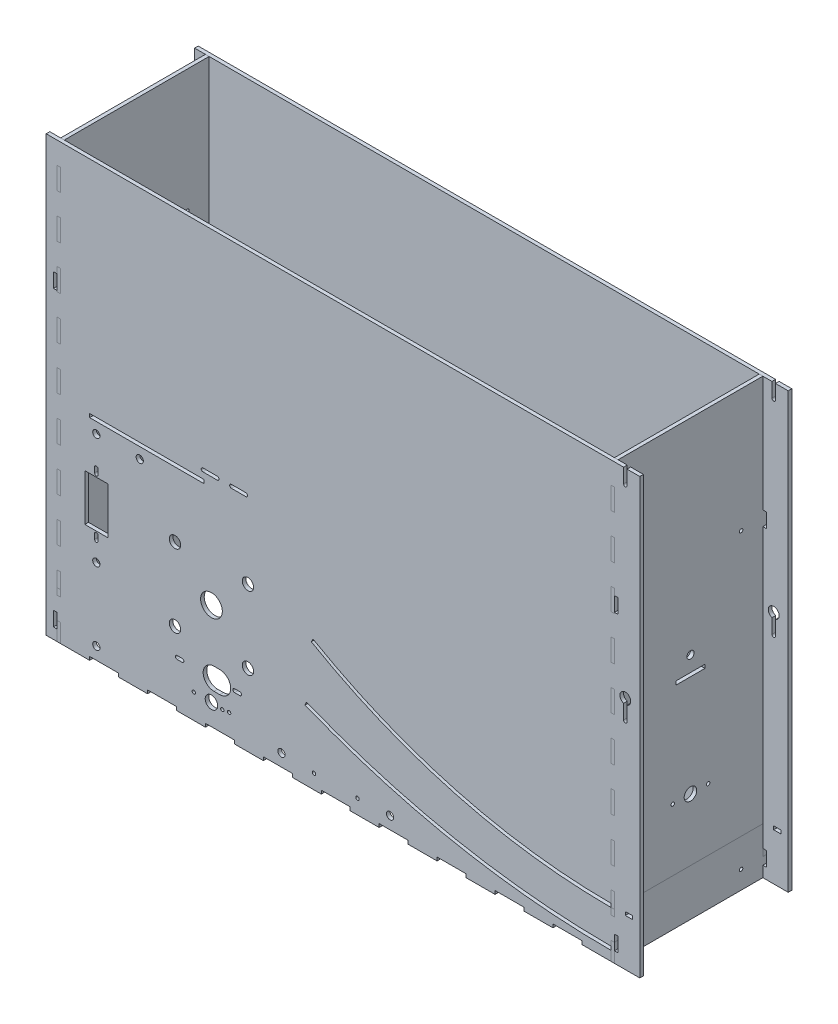
from build123d import *

# Parameters (mm, degrees)
SKETCH1_W                      = 488.95
SKETCH1_H                      = 133.35
SKETCH1_W_2                    = 482.6
SKETCH1_H_2                    = 127
BASE_EXTRUDE_DEPTH             = 3.175
SKETCH1_3_W                    = 488.95
SKETCH1_3_H                    = 133.35
SKETCH1_3_W_2                  = 482.6
SKETCH1_3_H_2                  = 127
WALL_EXTRUDE_DEPTH             = 384.175
WHEELRAMP7_W                   = 100.522513305
WHEELRAMP7_H                   = 3.175
WHEELRAMP7_R                   = 9.525
WHEELRAMP7_R_2                 = 5
CUT_EXTRUDE6_DEPTH             = 475.489914276
WHEELRAMP7_3_W                 = 20.2
WHEELRAMP7_3_H                 = 40.9
BRAKE_PAD_SERVO_CUT_DEPTH      = 475.489914276
WHEELRAMP7_4_R                 = 1.5
RATCHET_BRAKE_SERVO_CUT_DEPTH  = 475.489914276
WHEELRAMP7_5_R                 = 5.5
WHEELRAMP7_5_R_2               = 1.5
SOLENOIDBRAKE_DEPTH            = 475.489914276
SKETCH19_W                     = 25.4
SKETCH19_H                     = 3.175
SKETCH19_R                     = 3.175
SKETCH19_R_2                   = 5.5
SKETCH19_R_3                   = 1.5
SIDE_CUTS_DEPTH                = 626.386351586
SKETCH23_W                     = 6.35
SKETCH23_H                     = 2.9972
SKETCH23_W_2                   = 9.525
SKETCH23_H_2                   = 384.175
BOSS_EXTRUDE1_DEPTH            = 3.175
BOSS_EXTRUDE2_START            = -130.175
SKETCH23_2_W                   = 6.35
SKETCH23_2_H                   = 2.9972
SKETCH23_2_W_2                 = 9.525
SKETCH23_2_H_2                 = 384.175
BOSS_EXTRUDE2_DEPTH            = 3.175
SKETCH21_W                     = 12.827
SKETCH21_H                     = 6.477
SKETCH21_W_2                   = 6.477
SKETCH21_H_2                   = 12.827
SKETCH21_W_3                   = 3.175
BOTTOM_SUPPORT_HOLES_DEPTH     = 473.403298306
SPLIT1_START                   = 3.175
SPLIT1_OUTLINE_W               = 3.175
SPLIT1_OUTLINE_H               = 127
SPLIT1_DEPTH                   = 40.973335237
SPLIT1_2_OUTLINE_W             = 3.175
SPLIT1_2_OUTLINE_H             = 12.122727273
SPLIT1_2_DEPTH                 = 19.20875
SPLIT1_START_2                 = 38.4175
SPLIT1_3_OUTLINE_W             = 3.175
SPLIT1_3_OUTLINE_H             = 3.175
SPLIT1_3_DEPTH                 = 5.730835237
SPLIT1_START_3                 = -244.475
SPLIT1_4_OUTLINE_R             = 1.5
SPLIT1_4_OUTLINE_R_2           = 5.5
SPLIT1_4_OUTLINE_W             = 3.175
SPLIT1_4_OUTLINE_H             = 25.4
SPLIT1_4_OUTLINE_R_3           = 3.175
SPLIT1_4_DEPTH                 = 3.175
SPLIT1_5_OUTLINE_W             = 3.175
SPLIT1_5_OUTLINE_H             = 127
SPLIT1_5_DEPTH                 = 381.825
SPLIT1_START_4                 = -1
SPLIT1_6_OUTLINE_W             = 3.175
SPLIT1_6_OUTLINE_H             = 12.122727273
SPLIT1_6_DEPTH                 = 20.20875
SPLIT1_7_OUTLINE_W             = 3.175
SPLIT1_7_OUTLINE_H             = 3.175
SPLIT1_7_DEPTH                 = 19.20875
SPLIT1_START_5                 = 76.835
SPLIT1_8_OUTLINE_W             = 3.175
SPLIT1_8_OUTLINE_H             = 3.175
SPLIT1_8_DEPTH                 = 19.20875
SPLIT1_START_6                 = 115.2525
SPLIT1_9_OUTLINE_W             = 3.175
SPLIT1_9_OUTLINE_H             = 3.175
SPLIT1_9_DEPTH                 = 19.20875
SPLIT1_START_7                 = 153.67
SPLIT1_10_OUTLINE_W            = 3.175
SPLIT1_10_OUTLINE_H            = 3.175
SPLIT1_10_DEPTH                = 19.20875
SPLIT1_START_8                 = 192.0875
SPLIT1_11_OUTLINE_W            = 3.175
SPLIT1_11_OUTLINE_H            = 3.175
SPLIT1_11_DEPTH                = 19.20875
SPLIT1_START_9                 = 230.505
SPLIT1_12_OUTLINE_W            = 3.175
SPLIT1_12_OUTLINE_H            = 3.175
SPLIT1_12_DEPTH                = 19.20875
SPLIT1_START_10                = 268.9225
SPLIT1_13_OUTLINE_W            = 3.175
SPLIT1_13_OUTLINE_H            = 3.175
SPLIT1_13_DEPTH                = 19.20875
SPLIT1_START_11                = 307.34
SPLIT1_14_OUTLINE_W            = 3.175
SPLIT1_14_OUTLINE_H            = 3.175
SPLIT1_14_DEPTH                = 19.20875
SPLIT1_START_12                = 345.7575
SPLIT1_15_OUTLINE_W            = 3.175
SPLIT1_15_OUTLINE_H            = 3.175
SPLIT1_15_DEPTH                = 19.20875
SPLIT2_START                   = 3.175
SPLIT2_OUTLINE_W               = 3.175
SPLIT2_OUTLINE_H               = 127
SPLIT2_DEPTH                   = 40.973335237
SPLIT2_2_OUTLINE_W             = 3.175
SPLIT2_2_OUTLINE_H             = 12.122727273
SPLIT2_2_DEPTH                 = 19.20875
SPLIT2_START_2                 = 38.4175
SPLIT2_3_OUTLINE_W             = 3.175
SPLIT2_3_OUTLINE_H             = 3.175
SPLIT2_3_DEPTH                 = 5.730835237
SPLIT2_START_3                 = 241.3
SPLIT2_4_OUTLINE_R             = 1.5
SPLIT2_4_OUTLINE_R_2           = 5.5
SPLIT2_4_OUTLINE_W             = 3.175
SPLIT2_4_OUTLINE_H             = 25.4
SPLIT2_4_OUTLINE_R_3           = 3.175
SPLIT2_4_DEPTH                 = 3.175
SPLIT2_5_OUTLINE_W             = 3.175
SPLIT2_5_OUTLINE_H             = 127
SPLIT2_5_DEPTH                 = 381
SPLIT2_START_4                 = -1
SPLIT2_6_OUTLINE_W             = 3.175
SPLIT2_6_OUTLINE_H             = 12.122727273
SPLIT2_6_DEPTH                 = 20.20875
SPLIT2_7_OUTLINE_W             = 3.175
SPLIT2_7_OUTLINE_H             = 3.175
SPLIT2_7_DEPTH                 = 19.20875
SPLIT2_START_5                 = 76.835
SPLIT2_8_OUTLINE_W             = 3.175
SPLIT2_8_OUTLINE_H             = 3.175
SPLIT2_8_DEPTH                 = 19.20875
SPLIT2_START_6                 = 115.2525
SPLIT2_9_OUTLINE_W             = 3.175
SPLIT2_9_OUTLINE_H             = 3.175
SPLIT2_9_DEPTH                 = 19.20875
SPLIT2_START_7                 = 153.67
SPLIT2_10_OUTLINE_W            = 3.175
SPLIT2_10_OUTLINE_H            = 3.175
SPLIT2_10_DEPTH                = 19.20875
SPLIT2_START_8                 = 192.0875
SPLIT2_11_OUTLINE_W            = 3.175
SPLIT2_11_OUTLINE_H            = 3.175
SPLIT2_11_DEPTH                = 19.20875
SPLIT2_START_9                 = 230.505
SPLIT2_12_OUTLINE_W            = 3.175
SPLIT2_12_OUTLINE_H            = 3.175
SPLIT2_12_DEPTH                = 19.20875
SPLIT2_START_10                = 268.9225
SPLIT2_13_OUTLINE_W            = 3.175
SPLIT2_13_OUTLINE_H            = 3.175
SPLIT2_13_DEPTH                = 19.20875
SPLIT2_START_11                = 307.34
SPLIT2_14_OUTLINE_W            = 3.175
SPLIT2_14_OUTLINE_H            = 3.175
SPLIT2_14_DEPTH                = 19.20875
SPLIT2_START_12                = 345.7575
SPLIT2_15_OUTLINE_W            = 3.175
SPLIT2_15_OUTLINE_H            = 3.175
SPLIT2_15_DEPTH                = 19.20875
SKETCH22_W                     = 520.7
SKETCH22_H                     = 3.175
CUT_EXTRUDE5_DEPTH             = 487.314243185
SKETCH26_R                     = 1.5
SKETCH26_W                     = 3.175
SKETCH26_H                     = 12.7
FRONT_BACK_SUPPORT_HOLES_DEPTH = 487.314243185
SKETCH27_R                     = 1.5
SIDE_SUPPORT_HOLES_DEPTH       = 643.9120211
WHEELRAMP7_6_R                 = 3.175
WIREHOLECUT_DEPTH              = 487.314243185
SKETCH31_W                     = 25.4
SKETCH31_H                     = 6.1722
CUT_EXTRUDE10_DEPTH            = 487.314243185


with BuildPart() as part:
    # Sketch1 → Base Extrude (new body)
    # profile 1 of 2: a face of its own
    with BuildSketch(Plane(origin=(0, 0, 0), x_dir=(1, 0, 0), z_dir=(0, 1, 0))):
        Rectangle(SKETCH1_W, SKETCH1_H)
        Rectangle(SKETCH1_W_2, SKETCH1_H_2, mode=Mode.SUBTRACT)
    # profile 2 of 2: a face of its own
    with BuildSketch(Plane(origin=(0, 0, 0), x_dir=(1, 0, 0), z_dir=(0, 1, 0))):
        Rectangle(SKETCH1_W_2, SKETCH1_H_2)
    extrude(amount=BASE_EXTRUDE_DEPTH)

    # Sketch1<3> → Wall Extrude (add)
    with BuildSketch(Plane(origin=(0, 0, 0), x_dir=(1, 0, 0), z_dir=(0, 1, 0))):
        Rectangle(SKETCH1_3_W, SKETCH1_3_H)
        Rectangle(SKETCH1_3_W_2, SKETCH1_3_H_2, mode=Mode.SUBTRACT)
    extrude(amount=WALL_EXTRUDE_DEPTH)

    # WheelRamp7 → Cut-Extrude6 (cut, through all)
    with BuildSketch(Plane.XY.offset(66.675)):
        with BuildLine():
            Line((-19.862553934, 117.301630657), (-21.450053934, 114.552))
            ThreePointArc((-21.450053934, 114.552), (105.29056388, 62.054317198), (241.3, 44.148335237))
            Line((241.3, 44.148335237), (241.3, 47.323335237))
            ThreePointArc((241.3, 47.323335237), (106.112314349, 65.121131696), (-19.862553934, 117.301630657))
        make_face()
        with Locations((-165.638743347, 189.1665)):
            Rectangle(WHEELRAMP7_W, WHEELRAMP7_H)
        with BuildLine():
            Line((-103.827486695, 199.079), (-116.527486695, 199.079))
            ThreePointArc((-116.527486695, 199.079), (-118.027486695, 197.579), (-116.527486695, 196.079))
            Line((-116.527486695, 196.079), (-103.827486695, 196.079))
            ThreePointArc((-103.827486695, 196.079), (-102.327486695, 197.579), (-103.827486695, 199.079))
        make_face()
        with BuildLine():
            Line((-78.827486695, 199.079), (-91.527486695, 199.079))
            ThreePointArc((-91.527486695, 199.079), (-93.027486695, 197.579), (-91.527486695, 196.079))
            Line((-91.527486695, 196.079), (-78.827486695, 196.079))
            ThreePointArc((-78.827486695, 196.079), (-77.327486695, 197.579), (-78.827486695, 199.079))
        make_face()
        with BuildLine():
            Line((-25.734108325, 66.638172527), (-26.923484259, 63.694363788))
            ThreePointArc((-26.923484259, 63.694363788), (104.678129303, 24.712189892), (241.3, 11.557))
            Line((241.3, 11.557), (241.3, 14.732))
            ThreePointArc((241.3, 14.732), (105.283947863, 27.8288562), (-25.734108325, 66.638172527))
        make_face()
        with Locations((-109.027486695, 98.552)):
            Circle(WHEELRAMP7_R)
        with Locations((-141.027486695, 130.552)):
            Circle(WHEELRAMP7_R_2)
        with Locations((-77.027486695, 130.552)):
            Circle(WHEELRAMP7_R_2)
        with Locations((-141.027486695, 66.552)):
            Circle(WHEELRAMP7_R_2)
        with Locations((-77.027486695, 66.552)):
            Circle(WHEELRAMP7_R_2)
    extrude(amount=-CUT_EXTRUDE6_DEPTH, mode=Mode.SUBTRACT)

    # WheelRamp7<3> → Brake Pad Servo Cut (cut, through all)
    with BuildSketch(Plane.XY.offset(66.675)):
        with Locations((-210.035686695, 124.7948)):
            Rectangle(WHEELRAMP7_3_W, WHEELRAMP7_3_H)
        with BuildLine():
            Line((-211.535686695, 101.7948), (-211.535686695, 97.2948))
            ThreePointArc((-211.535686695, 97.2948), (-210.035686695, 95.7948), (-208.535686695, 97.2948))
            Line((-208.535686695, 97.2948), (-208.535686695, 101.7948))
            ThreePointArc((-208.535686695, 101.7948), (-210.035686695, 103.2948), (-211.535686695, 101.7948))
        make_face()
        with BuildLine():
            Line((-208.535686695, 147.7948), (-208.535686695, 152.2948))
            ThreePointArc((-208.535686695, 152.2948), (-210.035686695, 153.7948), (-211.535686695, 152.2948))
            Line((-211.535686695, 152.2948), (-211.535686695, 147.7948))
            ThreePointArc((-211.535686695, 147.7948), (-210.035686695, 146.2948), (-208.535686695, 147.7948))
        make_face()
    extrude(amount=-BRAKE_PAD_SERVO_CUT_DEPTH, mode=Mode.SUBTRACT)

    # WheelRamp7<4> → Ratchet Brake Servo Cut (cut, through all)
    with BuildSketch(Plane.XY.offset(66.675)):
        with Locations((-99.502486695, 24.0114074)):
            Circle(WHEELRAMP7_4_R)
        with BuildLine():
            Line((-101.697486695, 34.227), (-106.777486695, 34.227))
            ThreePointArc((-106.777486695, 34.227), (-116.302486695, 43.752), (-106.777486695, 53.277))
            Line((-106.777486695, 53.277), (-101.697486695, 53.277))
            ThreePointArc((-101.697486695, 53.277), (-92.172486695, 43.752), (-101.697486695, 34.227))
        make_face()
        with BuildLine():
            Line((-139.187486695, 45.252), (-134.687486695, 45.252))
            ThreePointArc((-134.687486695, 45.252), (-133.187486695, 43.752), (-134.687486695, 42.252))
            Line((-134.687486695, 42.252), (-139.187486695, 42.252))
            ThreePointArc((-139.187486695, 42.252), (-140.687486695, 43.752), (-139.187486695, 45.252))
        make_face()
        with BuildLine():
            Line((-84.187486695, 42.252), (-88.687486695, 42.252))
            ThreePointArc((-88.687486695, 42.252), (-90.187486695, 43.752), (-88.687486695, 45.252))
            Line((-88.687486695, 45.252), (-84.187486695, 45.252))
            ThreePointArc((-84.187486695, 45.252), (-82.687486695, 43.752), (-84.187486695, 42.252))
        make_face()
    extrude(amount=-RATCHET_BRAKE_SERVO_CUT_DEPTH, mode=Mode.SUBTRACT)

    # WheelRamp7<5> → SolenoidBrake (cut, through all)
    with BuildSketch(Plane.XY.offset(66.675)):
        with Locations((-109.027486695, 24.765)):
            Circle(WHEELRAMP7_5_R)
        with Locations((-124.527486695, 24.765)):
            Circle(WHEELRAMP7_5_R_2)
        with Locations((-93.527486695, 24.765)):
            Circle(WHEELRAMP7_5_R_2)
    extrude(amount=-SOLENOIDBRAKE_DEPTH, mode=Mode.SUBTRACT)

    # Sketch19 → Side Cuts (cut, through all)
    with BuildSketch(Plane.ZY.offset(244.475)):
        with Locations((0, 189.1665)):
            Rectangle(SKETCH19_W, SKETCH19_H)
        with Locations((0, 204.216)):
            Circle(SKETCH19_R)
        with Locations((0, 98.552)):
            Circle(SKETCH19_R_2)
        with Locations((-15.5, 98.552)):
            Circle(SKETCH19_R_3)
        with Locations((15.5, 98.552)):
            Circle(SKETCH19_R_3)
    extrude(amount=-SIDE_CUTS_DEPTH, mode=Mode.SUBTRACT)

    # Sketch23 → Boss-Extrude1 (add)
    # profile 1 of 2: a face of its own
    with BuildSketch(Plane.XY.offset(66.675)):
        with BuildLine():
            Line((252.5, 384.175), (244.475, 384.175))
            Line((244.475, 384.175), (244.475, 0))
            Line((244.475, 0), (266.7, 0))
            Line((266.7, 0), (266.7, 384.175))
            Line((266.7, 384.175), (255.5, 384.175))
            Line((255.5, 384.175), (255.5, 371.475))
            ThreePointArc((255.5, 371.475), (254, 369.975), (252.5, 371.475))
            Line((252.5, 371.475), (252.5, 384.175))
        make_face()
        with Locations((257.175, 45.824735237)):
            Rectangle(SKETCH23_W, SKETCH23_H, mode=Mode.SUBTRACT)
        with BuildLine():
            Line((252.5, 192.0875), (252.5, 204.7875))
            ThreePointArc((252.5, 204.7875), (251.212738239, 213.169292048), (258.7625, 209.307611309))
            ThreePointArc((258.7625, 209.307611309), (257.861680738, 206.520349548), (255.5, 204.7875))
            Line((255.5, 204.7875), (255.5, 192.0875))
            ThreePointArc((255.5, 192.0875), (254, 190.5875), (252.5, 192.0875))
        make_face(mode=Mode.SUBTRACT)
    # profile 2 of 2: a face of its own
    with BuildSketch(Plane.XY.offset(66.675)):
        with Locations((-249.2375, 192.0875)):
            Rectangle(SKETCH23_W_2, SKETCH23_H_2)
    extrude(amount=-BOSS_EXTRUDE1_DEPTH)

    # Sketch23<2> → Boss-Extrude2 (add)
    # profile 1 of 2: a face of its own
    with BuildSketch(Plane.XY.offset(66.675).offset(BOSS_EXTRUDE2_START)):
        with BuildLine():
            Line((252.5, 384.175), (244.475, 384.175))
            Line((244.475, 384.175), (244.475, 0))
            Line((244.475, 0), (266.7, 0))
            Line((266.7, 0), (266.7, 384.175))
            Line((266.7, 384.175), (255.5, 384.175))
            Line((255.5, 384.175), (255.5, 371.475))
            ThreePointArc((255.5, 371.475), (254, 369.975), (252.5, 371.475))
            Line((252.5, 371.475), (252.5, 384.175))
        make_face()
        with Locations((257.175, 45.824735237)):
            Rectangle(SKETCH23_2_W, SKETCH23_2_H, mode=Mode.SUBTRACT)
        with BuildLine():
            Line((252.5, 192.0875), (252.5, 204.7875))
            ThreePointArc((252.5, 204.7875), (251.212738239, 213.169292048), (258.7625, 209.307611309))
            ThreePointArc((258.7625, 209.307611309), (257.861680738, 206.520349548), (255.5, 204.7875))
            Line((255.5, 204.7875), (255.5, 192.0875))
            ThreePointArc((255.5, 192.0875), (254, 190.5875), (252.5, 192.0875))
        make_face(mode=Mode.SUBTRACT)
    # profile 2 of 2: a face of its own
    with BuildSketch(Plane.XY.offset(66.675).offset(BOSS_EXTRUDE2_START)):
        with Locations((-249.2375, 192.0875)):
            Rectangle(SKETCH23_2_W_2, SKETCH23_2_H_2)
    extrude(amount=-BOSS_EXTRUDE2_DEPTH)

    # Sketch21 → Bottom Support Holes (cut, through all)
    with BuildSketch(Plane.XZ):
        with Locations((0, 50.7365)):
            Rectangle(SKETCH21_W, SKETCH21_H)
        with Locations((-228.5365, 0)):
            Rectangle(SKETCH21_W_2, SKETCH21_H_2)
        with Locations((0, -50.7365)):
            Rectangle(SKETCH21_W, SKETCH21_H)
        with Locations((230.1875, 0)):
            Rectangle(SKETCH21_W_3, SKETCH21_H_2)
    extrude(amount=-BOTTOM_SUPPORT_HOLES_DEPTH, mode=Mode.SUBTRACT)

    # Split1 5 outline → Split1 5 (cut)
    with BuildSketch(Plane(origin=(0, 0, 0), x_dir=(1, 0, 0), z_dir=(0, 1, 0)).offset(SPLIT1_START)):
        with Locations((-242.8875, 0)):
            Rectangle(SPLIT1_5_OUTLINE_W, SPLIT1_5_OUTLINE_H)
    extrude(amount=SPLIT1_5_DEPTH, mode=Mode.SUBTRACT)

    # Split1 6 outline → Split1 6 (cut)
    with BuildSketch(Plane(origin=(0, 0, 0), x_dir=(1, 0, 0), z_dir=(0, 1, 0)).offset(SPLIT1_START_4)):
        with Locations((-242.8875, 60.613636363)):
            Rectangle(SPLIT1_6_OUTLINE_W, SPLIT1_6_OUTLINE_H)
        with Locations((-242.8875, 36.368181819)):
            Rectangle(SPLIT1_6_OUTLINE_W, SPLIT1_6_OUTLINE_H)
        with Locations((-242.8875, 12.122727273)):
            Rectangle(SPLIT1_6_OUTLINE_W, SPLIT1_6_OUTLINE_H)
        with Locations((-242.8875, -12.122727273)):
            Rectangle(SPLIT1_6_OUTLINE_W, SPLIT1_6_OUTLINE_H)
        with Locations((-242.8875, -36.368181819)):
            Rectangle(SPLIT1_6_OUTLINE_W, SPLIT1_6_OUTLINE_H)
        with Locations((-242.8875, -60.613636363)):
            Rectangle(SPLIT1_6_OUTLINE_W, SPLIT1_6_OUTLINE_H)
    extrude(amount=SPLIT1_6_DEPTH, mode=Mode.SUBTRACT)

    # Split1 7 outline → Split1 7 (cut)
    with BuildSketch(Plane(origin=(0, 0, 0), x_dir=(1, 0, 0), z_dir=(0, 1, 0)).offset(SPLIT1_START_2)):
        with Locations((-242.8875, 65.0875)):
            Rectangle(SPLIT1_7_OUTLINE_W, SPLIT1_7_OUTLINE_H)
        with Locations((-242.8875, -65.0875)):
            Rectangle(SPLIT1_7_OUTLINE_W, SPLIT1_7_OUTLINE_H)
    extrude(amount=SPLIT1_7_DEPTH, mode=Mode.SUBTRACT)

    # Split1 8 outline → Split1 8 (cut)
    with BuildSketch(Plane(origin=(0, 0, 0), x_dir=(1, 0, 0), z_dir=(0, 1, 0)).offset(SPLIT1_START_5)):
        with Locations((-242.8875, 65.0875)):
            Rectangle(SPLIT1_8_OUTLINE_W, SPLIT1_8_OUTLINE_H)
        with Locations((-242.8875, -65.0875)):
            Rectangle(SPLIT1_8_OUTLINE_W, SPLIT1_8_OUTLINE_H)
    extrude(amount=SPLIT1_8_DEPTH, mode=Mode.SUBTRACT)

    # Split1 9 outline → Split1 9 (cut)
    with BuildSketch(Plane(origin=(0, 0, 0), x_dir=(1, 0, 0), z_dir=(0, 1, 0)).offset(SPLIT1_START_6)):
        with Locations((-242.8875, 65.0875)):
            Rectangle(SPLIT1_9_OUTLINE_W, SPLIT1_9_OUTLINE_H)
        with Locations((-242.8875, -65.0875)):
            Rectangle(SPLIT1_9_OUTLINE_W, SPLIT1_9_OUTLINE_H)
    extrude(amount=SPLIT1_9_DEPTH, mode=Mode.SUBTRACT)

    # Split1 10 outline → Split1 10 (cut)
    with BuildSketch(Plane(origin=(0, 0, 0), x_dir=(1, 0, 0), z_dir=(0, 1, 0)).offset(SPLIT1_START_7)):
        with Locations((-242.8875, 65.0875)):
            Rectangle(SPLIT1_10_OUTLINE_W, SPLIT1_10_OUTLINE_H)
        with Locations((-242.8875, -65.0875)):
            Rectangle(SPLIT1_10_OUTLINE_W, SPLIT1_10_OUTLINE_H)
    extrude(amount=SPLIT1_10_DEPTH, mode=Mode.SUBTRACT)

    # Split1 11 outline → Split1 11 (cut)
    with BuildSketch(Plane(origin=(0, 0, 0), x_dir=(1, 0, 0), z_dir=(0, 1, 0)).offset(SPLIT1_START_8)):
        with Locations((-242.8875, 65.0875)):
            Rectangle(SPLIT1_11_OUTLINE_W, SPLIT1_11_OUTLINE_H)
        with Locations((-242.8875, -65.0875)):
            Rectangle(SPLIT1_11_OUTLINE_W, SPLIT1_11_OUTLINE_H)
    extrude(amount=SPLIT1_11_DEPTH, mode=Mode.SUBTRACT)

    # Split1 12 outline → Split1 12 (cut)
    with BuildSketch(Plane(origin=(0, 0, 0), x_dir=(1, 0, 0), z_dir=(0, 1, 0)).offset(SPLIT1_START_9)):
        with Locations((-242.8875, 65.0875)):
            Rectangle(SPLIT1_12_OUTLINE_W, SPLIT1_12_OUTLINE_H)
        with Locations((-242.8875, -65.0875)):
            Rectangle(SPLIT1_12_OUTLINE_W, SPLIT1_12_OUTLINE_H)
    extrude(amount=SPLIT1_12_DEPTH, mode=Mode.SUBTRACT)

    # Split1 13 outline → Split1 13 (cut)
    with BuildSketch(Plane(origin=(0, 0, 0), x_dir=(1, 0, 0), z_dir=(0, 1, 0)).offset(SPLIT1_START_10)):
        with Locations((-242.8875, 65.0875)):
            Rectangle(SPLIT1_13_OUTLINE_W, SPLIT1_13_OUTLINE_H)
        with Locations((-242.8875, -65.0875)):
            Rectangle(SPLIT1_13_OUTLINE_W, SPLIT1_13_OUTLINE_H)
    extrude(amount=SPLIT1_13_DEPTH, mode=Mode.SUBTRACT)

    # Split1 14 outline → Split1 14 (cut)
    with BuildSketch(Plane(origin=(0, 0, 0), x_dir=(1, 0, 0), z_dir=(0, 1, 0)).offset(SPLIT1_START_11)):
        with Locations((-242.8875, 65.0875)):
            Rectangle(SPLIT1_14_OUTLINE_W, SPLIT1_14_OUTLINE_H)
        with Locations((-242.8875, -65.0875)):
            Rectangle(SPLIT1_14_OUTLINE_W, SPLIT1_14_OUTLINE_H)
    extrude(amount=SPLIT1_14_DEPTH, mode=Mode.SUBTRACT)

    # Split1 15 outline → Split1 15 (cut)
    with BuildSketch(Plane(origin=(0, 0, 0), x_dir=(1, 0, 0), z_dir=(0, 1, 0)).offset(SPLIT1_START_12)):
        with Locations((-242.8875, 65.0875)):
            Rectangle(SPLIT1_15_OUTLINE_W, SPLIT1_15_OUTLINE_H)
        with Locations((-242.8875, -65.0875)):
            Rectangle(SPLIT1_15_OUTLINE_W, SPLIT1_15_OUTLINE_H)
    extrude(amount=SPLIT1_15_DEPTH, mode=Mode.SUBTRACT)

    # Split2 5 outline → Split2 5 (cut)
    with BuildSketch(Plane(origin=(0, 0, 0), x_dir=(1, 0, 0), z_dir=(0, 1, 0)).offset(SPLIT2_START)):
        with Locations((242.8875, 0)):
            Rectangle(SPLIT2_5_OUTLINE_W, SPLIT2_5_OUTLINE_H)
    extrude(amount=SPLIT2_5_DEPTH, mode=Mode.SUBTRACT)

    # Split2 6 outline → Split2 6 (cut)
    with BuildSketch(Plane(origin=(0, 0, 0), x_dir=(1, 0, 0), z_dir=(0, 1, 0)).offset(SPLIT2_START_4)):
        with Locations((242.8875, 60.613636363)):
            Rectangle(SPLIT2_6_OUTLINE_W, SPLIT2_6_OUTLINE_H)
        with Locations((242.8875, 36.368181819)):
            Rectangle(SPLIT2_6_OUTLINE_W, SPLIT2_6_OUTLINE_H)
        with Locations((242.8875, 12.122727273)):
            Rectangle(SPLIT2_6_OUTLINE_W, SPLIT2_6_OUTLINE_H)
        with Locations((242.8875, -12.122727273)):
            Rectangle(SPLIT2_6_OUTLINE_W, SPLIT2_6_OUTLINE_H)
        with Locations((242.8875, -36.368181819)):
            Rectangle(SPLIT2_6_OUTLINE_W, SPLIT2_6_OUTLINE_H)
        with Locations((242.8875, -60.613636363)):
            Rectangle(SPLIT2_6_OUTLINE_W, SPLIT2_6_OUTLINE_H)
    extrude(amount=SPLIT2_6_DEPTH, mode=Mode.SUBTRACT)

    # Split2 7 outline → Split2 7 (cut)
    with BuildSketch(Plane(origin=(0, 0, 0), x_dir=(1, 0, 0), z_dir=(0, 1, 0)).offset(SPLIT2_START_2)):
        with Locations((242.8875, 65.0875)):
            Rectangle(SPLIT2_7_OUTLINE_W, SPLIT2_7_OUTLINE_H)
        with Locations((242.8875, -65.0875)):
            Rectangle(SPLIT2_7_OUTLINE_W, SPLIT2_7_OUTLINE_H)
    extrude(amount=SPLIT2_7_DEPTH, mode=Mode.SUBTRACT)

    # Split2 8 outline → Split2 8 (cut)
    with BuildSketch(Plane(origin=(0, 0, 0), x_dir=(1, 0, 0), z_dir=(0, 1, 0)).offset(SPLIT2_START_5)):
        with Locations((242.8875, 65.0875)):
            Rectangle(SPLIT2_8_OUTLINE_W, SPLIT2_8_OUTLINE_H)
        with Locations((242.8875, -65.0875)):
            Rectangle(SPLIT2_8_OUTLINE_W, SPLIT2_8_OUTLINE_H)
    extrude(amount=SPLIT2_8_DEPTH, mode=Mode.SUBTRACT)

    # Split2 9 outline → Split2 9 (cut)
    with BuildSketch(Plane(origin=(0, 0, 0), x_dir=(1, 0, 0), z_dir=(0, 1, 0)).offset(SPLIT2_START_6)):
        with Locations((242.8875, 65.0875)):
            Rectangle(SPLIT2_9_OUTLINE_W, SPLIT2_9_OUTLINE_H)
        with Locations((242.8875, -65.0875)):
            Rectangle(SPLIT2_9_OUTLINE_W, SPLIT2_9_OUTLINE_H)
    extrude(amount=SPLIT2_9_DEPTH, mode=Mode.SUBTRACT)

    # Split2 10 outline → Split2 10 (cut)
    with BuildSketch(Plane(origin=(0, 0, 0), x_dir=(1, 0, 0), z_dir=(0, 1, 0)).offset(SPLIT2_START_7)):
        with Locations((242.8875, 65.0875)):
            Rectangle(SPLIT2_10_OUTLINE_W, SPLIT2_10_OUTLINE_H)
        with Locations((242.8875, -65.0875)):
            Rectangle(SPLIT2_10_OUTLINE_W, SPLIT2_10_OUTLINE_H)
    extrude(amount=SPLIT2_10_DEPTH, mode=Mode.SUBTRACT)

    # Split2 11 outline → Split2 11 (cut)
    with BuildSketch(Plane(origin=(0, 0, 0), x_dir=(1, 0, 0), z_dir=(0, 1, 0)).offset(SPLIT2_START_8)):
        with Locations((242.8875, 65.0875)):
            Rectangle(SPLIT2_11_OUTLINE_W, SPLIT2_11_OUTLINE_H)
        with Locations((242.8875, -65.0875)):
            Rectangle(SPLIT2_11_OUTLINE_W, SPLIT2_11_OUTLINE_H)
    extrude(amount=SPLIT2_11_DEPTH, mode=Mode.SUBTRACT)

    # Split2 12 outline → Split2 12 (cut)
    with BuildSketch(Plane(origin=(0, 0, 0), x_dir=(1, 0, 0), z_dir=(0, 1, 0)).offset(SPLIT2_START_9)):
        with Locations((242.8875, 65.0875)):
            Rectangle(SPLIT2_12_OUTLINE_W, SPLIT2_12_OUTLINE_H)
        with Locations((242.8875, -65.0875)):
            Rectangle(SPLIT2_12_OUTLINE_W, SPLIT2_12_OUTLINE_H)
    extrude(amount=SPLIT2_12_DEPTH, mode=Mode.SUBTRACT)

    # Split2 13 outline → Split2 13 (cut)
    with BuildSketch(Plane(origin=(0, 0, 0), x_dir=(1, 0, 0), z_dir=(0, 1, 0)).offset(SPLIT2_START_10)):
        with Locations((242.8875, 65.0875)):
            Rectangle(SPLIT2_13_OUTLINE_W, SPLIT2_13_OUTLINE_H)
        with Locations((242.8875, -65.0875)):
            Rectangle(SPLIT2_13_OUTLINE_W, SPLIT2_13_OUTLINE_H)
    extrude(amount=SPLIT2_13_DEPTH, mode=Mode.SUBTRACT)

    # Split2 14 outline → Split2 14 (cut)
    with BuildSketch(Plane(origin=(0, 0, 0), x_dir=(1, 0, 0), z_dir=(0, 1, 0)).offset(SPLIT2_START_11)):
        with Locations((242.8875, 65.0875)):
            Rectangle(SPLIT2_14_OUTLINE_W, SPLIT2_14_OUTLINE_H)
        with Locations((242.8875, -65.0875)):
            Rectangle(SPLIT2_14_OUTLINE_W, SPLIT2_14_OUTLINE_H)
    extrude(amount=SPLIT2_14_DEPTH, mode=Mode.SUBTRACT)

    # Split2 15 outline → Split2 15 (cut)
    with BuildSketch(Plane(origin=(0, 0, 0), x_dir=(1, 0, 0), z_dir=(0, 1, 0)).offset(SPLIT2_START_12)):
        with Locations((242.8875, 65.0875)):
            Rectangle(SPLIT2_15_OUTLINE_W, SPLIT2_15_OUTLINE_H)
        with Locations((242.8875, -65.0875)):
            Rectangle(SPLIT2_15_OUTLINE_W, SPLIT2_15_OUTLINE_H)
    extrude(amount=SPLIT2_15_DEPTH, mode=Mode.SUBTRACT)


with BuildPart() as body_2:
    # Split1: read off the stored shape, not the designer's step
    # Split1 outline → Split1 (new body)
    with BuildSketch(Plane(origin=(0, 0, 0), x_dir=(1, 0, 0), z_dir=(0, 1, 0)).offset(SPLIT1_START)):
        with Locations((-242.8875, 0)):
            Rectangle(SPLIT1_OUTLINE_W, SPLIT1_OUTLINE_H)
    extrude(amount=SPLIT1_DEPTH)

    # Split1 2 outline → Split1 2 (add)
    with BuildSketch(Plane(origin=(0, 0, 0), x_dir=(1, 0, 0), z_dir=(0, 1, 0))):
        with Locations((-242.8875, -60.613636363)):
            Rectangle(SPLIT1_2_OUTLINE_W, SPLIT1_2_OUTLINE_H)
        with Locations((-242.8875, -36.368181819)):
            Rectangle(SPLIT1_2_OUTLINE_W, SPLIT1_2_OUTLINE_H)
        with Locations((-242.8875, -12.122727273)):
            Rectangle(SPLIT1_2_OUTLINE_W, SPLIT1_2_OUTLINE_H)
        with Locations((-242.8875, 12.122727273)):
            Rectangle(SPLIT1_2_OUTLINE_W, SPLIT1_2_OUTLINE_H)
        with Locations((-242.8875, 36.368181819)):
            Rectangle(SPLIT1_2_OUTLINE_W, SPLIT1_2_OUTLINE_H)
        with Locations((-242.8875, 60.613636363)):
            Rectangle(SPLIT1_2_OUTLINE_W, SPLIT1_2_OUTLINE_H)
    extrude(amount=SPLIT1_2_DEPTH)

    # Split1 3 outline → Split1 3 (add)
    with BuildSketch(Plane(origin=(0, 0, 0), x_dir=(1, 0, 0), z_dir=(0, 1, 0)).offset(SPLIT1_START_2)):
        with Locations((-242.8875, -65.0875)):
            Rectangle(SPLIT1_3_OUTLINE_W, SPLIT1_3_OUTLINE_H)
        with Locations((-242.8875, 65.0875)):
            Rectangle(SPLIT1_3_OUTLINE_W, SPLIT1_3_OUTLINE_H)
    extrude(amount=SPLIT1_3_DEPTH)


with BuildPart() as body_3:
    # Split1 4 outline → Split1 4 (new body)
    with BuildSketch(Plane.YZ.offset(SPLIT1_START_3)):
        Polygon((364.96625, -63.5), (384.175, -63.5), (384.175, 63.5), (364.96625, 63.5), (364.96625, 66.675), (345.7575, 66.675), (345.7575, 63.5), (326.54875, 63.5), (326.54875, 66.675), (307.34, 66.675), (307.34, 63.5), (288.13125, 63.5), (288.13125, 66.675), (268.9225, 66.675), (268.9225, 63.5), (249.71375, 63.5), (249.71375, 66.675), (230.505, 66.675), (230.505, 63.5), (211.29625, 63.5), (211.29625, 66.675), (192.0875, 66.675), (192.0875, 63.5), (172.87875, 63.5), (172.87875, 66.675), (153.67, 66.675), (153.67, 63.5), (134.46125, 63.5), (134.46125, 66.675), (115.2525, 66.675), (115.2525, 63.5), (96.04375, 63.5), (96.04375, 66.675), (76.835, 66.675), (76.835, 63.5), (57.62625, 63.5), (57.62625, 66.675), (44.148335237, 66.675), (44.148335237, -66.675), (57.62625, -66.675), (57.62625, -63.5), (76.835, -63.5), (76.835, -66.675), (96.04375, -66.675), (96.04375, -63.5), (115.2525, -63.5), (115.2525, -66.675), (134.46125, -66.675), (134.46125, -63.5), (153.67, -63.5), (153.67, -66.675), (172.87875, -66.675), (172.87875, -63.5), (192.0875, -63.5), (192.0875, -66.675), (211.29625, -66.675), (211.29625, -63.5), (230.505, -63.5), (230.505, -66.675), (249.71375, -66.675), (249.71375, -63.5), (268.9225, -63.5), (268.9225, -66.675), (288.13125, -66.675), (288.13125, -63.5), (307.34, -63.5), (307.34, -66.675), (326.54875, -66.675), (326.54875, -63.5), (345.7575, -63.5), (345.7575, -66.675), (364.96625, -66.675), align=None)
        with Locations((98.552, -15.5)):
            Circle(SPLIT1_4_OUTLINE_R, mode=Mode.SUBTRACT)
        with Locations((98.552, 0)):
            Circle(SPLIT1_4_OUTLINE_R_2, mode=Mode.SUBTRACT)
        with Locations((98.552, 15.5)):
            Circle(SPLIT1_4_OUTLINE_R, mode=Mode.SUBTRACT)
        with Locations((189.1665, 0)):
            Rectangle(SPLIT1_4_OUTLINE_W, SPLIT1_4_OUTLINE_H, mode=Mode.SUBTRACT)
        with Locations((204.216, 0)):
            Circle(SPLIT1_4_OUTLINE_R_3, mode=Mode.SUBTRACT)
    extrude(amount=SPLIT1_4_DEPTH)


with BuildPart() as body_4:
    # Split2: read off the stored shape, not the designer's step
    # Split2 outline → Split2 (new body)
    with BuildSketch(Plane(origin=(0, 0, 0), x_dir=(1, 0, 0), z_dir=(0, 1, 0)).offset(SPLIT2_START)):
        with Locations((242.8875, 0)):
            Rectangle(SPLIT2_OUTLINE_W, SPLIT2_OUTLINE_H)
    extrude(amount=SPLIT2_DEPTH)

    # Split2 2 outline → Split2 2 (add)
    with BuildSketch(Plane(origin=(0, 0, 0), x_dir=(1, 0, 0), z_dir=(0, 1, 0))):
        with Locations((242.8875, 36.368181819)):
            Rectangle(SPLIT2_2_OUTLINE_W, SPLIT2_2_OUTLINE_H)
        with Locations((242.8875, 60.613636363)):
            Rectangle(SPLIT2_2_OUTLINE_W, SPLIT2_2_OUTLINE_H)
        with Locations((242.8875, 12.122727273)):
            Rectangle(SPLIT2_2_OUTLINE_W, SPLIT2_2_OUTLINE_H)
        with Locations((242.8875, -12.122727273)):
            Rectangle(SPLIT2_2_OUTLINE_W, SPLIT2_2_OUTLINE_H)
        with Locations((242.8875, -36.368181819)):
            Rectangle(SPLIT2_2_OUTLINE_W, SPLIT2_2_OUTLINE_H)
        with Locations((242.8875, -60.613636363)):
            Rectangle(SPLIT2_2_OUTLINE_W, SPLIT2_2_OUTLINE_H)
    extrude(amount=SPLIT2_2_DEPTH)

    # Split2 3 outline → Split2 3 (add)
    with BuildSketch(Plane(origin=(0, 0, 0), x_dir=(1, 0, 0), z_dir=(0, 1, 0)).offset(SPLIT2_START_2)):
        with Locations((242.8875, 65.0875)):
            Rectangle(SPLIT2_3_OUTLINE_W, SPLIT2_3_OUTLINE_H)
        with Locations((242.8875, -65.0875)):
            Rectangle(SPLIT2_3_OUTLINE_W, SPLIT2_3_OUTLINE_H)
    extrude(amount=SPLIT2_3_DEPTH)


with BuildPart() as body_5:
    # Split2 4 outline → Split2 4 (new body)
    with BuildSketch(Plane.YZ.offset(SPLIT2_START_3)):
        Polygon((44.148335237, 66.675), (44.148335237, -66.675), (57.62625, -66.675), (57.62625, -63.5), (76.835, -63.5), (76.835, -66.675), (96.04375, -66.675), (96.04375, -63.5), (115.2525, -63.5), (115.2525, -66.675), (134.46125, -66.675), (134.46125, -63.5), (153.67, -63.5), (153.67, -66.675), (172.87875, -66.675), (172.87875, -63.5), (192.0875, -63.5), (192.0875, -66.675), (211.29625, -66.675), (211.29625, -63.5), (230.505, -63.5), (230.505, -66.675), (249.71375, -66.675), (249.71375, -63.5), (268.9225, -63.5), (268.9225, -66.675), (288.13125, -66.675), (288.13125, -63.5), (307.34, -63.5), (307.34, -66.675), (326.54875, -66.675), (326.54875, -63.5), (345.7575, -63.5), (345.7575, -66.675), (364.96625, -66.675), (364.96625, -63.5), (384.175, -63.5), (384.175, 63.5), (364.96625, 63.5), (364.96625, 66.675), (345.7575, 66.675), (345.7575, 63.5), (326.54875, 63.5), (326.54875, 66.675), (307.34, 66.675), (307.34, 63.5), (288.13125, 63.5), (288.13125, 66.675), (268.9225, 66.675), (268.9225, 63.5), (249.71375, 63.5), (249.71375, 66.675), (230.505, 66.675), (230.505, 63.5), (211.29625, 63.5), (211.29625, 66.675), (192.0875, 66.675), (192.0875, 63.5), (172.87875, 63.5), (172.87875, 66.675), (153.67, 66.675), (153.67, 63.5), (134.46125, 63.5), (134.46125, 66.675), (115.2525, 66.675), (115.2525, 63.5), (96.04375, 63.5), (96.04375, 66.675), (76.835, 66.675), (76.835, 63.5), (57.62625, 63.5), (57.62625, 66.675), align=None)
        with Locations((98.552, -15.5)):
            Circle(SPLIT2_4_OUTLINE_R, mode=Mode.SUBTRACT)
        with Locations((98.552, 0)):
            Circle(SPLIT2_4_OUTLINE_R_2, mode=Mode.SUBTRACT)
        with Locations((98.552, 15.5)):
            Circle(SPLIT2_4_OUTLINE_R, mode=Mode.SUBTRACT)
        with Locations((189.1665, 0)):
            Rectangle(SPLIT2_4_OUTLINE_W, SPLIT2_4_OUTLINE_H, mode=Mode.SUBTRACT)
        with Locations((204.216, 0)):
            Circle(SPLIT2_4_OUTLINE_R_3, mode=Mode.SUBTRACT)
    extrude(amount=SPLIT2_4_DEPTH)


with BuildPart() as cut_extrude5_tool:
    # Sketch22 → Cut-Extrude5 (new, through all)
    with BuildSketch(Plane.XY.offset(66.675)):
        with Locations((6.35, 1.5875)):
            Rectangle(SKETCH22_W, SKETCH22_H)
    extrude(amount=-CUT_EXTRUDE5_DEPTH)


with BuildPart() as part_1:
    add(part.part)

    # Cut-Extrude5: cut by cut_extrude5_tool
    add(cut_extrude5_tool.part, mode=Mode.SUBTRACT)

    # Sketch26 → Front/Back Support Holes (cut, through all)
    with BuildSketch(Plane.XY.offset(66.675)):
        with Locations((-19.05, 15.875)):
            Circle(SKETCH26_R)
        with Locations((19.05, 15.875)):
            Circle(SKETCH26_R)
        with Locations((246.0625, 19.05)):
            Rectangle(SKETCH26_W, SKETCH26_H)
        with Locations((-246.0625, 19.05)):
            Rectangle(SKETCH26_W, SKETCH26_H)
        with Locations((246.0625, 276.225)):
            Rectangle(SKETCH26_W, SKETCH26_H)
        with Locations((-246.0625, 276.225)):
            Rectangle(SKETCH26_W, SKETCH26_H)
    extrude(amount=-FRONT_BACK_SUPPORT_HOLES_DEPTH, mode=Mode.SUBTRACT)

    # WheelRamp7<6> → WireHoleCut (cut, through all)
    with BuildSketch(Plane.XY.offset(66.675)):
        with Locations((-210.035686695, 80.4948)):
            Circle(WHEELRAMP7_6_R)
        with Locations((-210.035686695, 16.9948)):
            Circle(WHEELRAMP7_6_R)
        with Locations((-47.625, 16.9948)):
            Circle(WHEELRAMP7_6_R)
        with Locations((47.625, 16.9948)):
            Circle(WHEELRAMP7_6_R)
        with Locations((-210.035686695, 178.054)):
            Circle(WHEELRAMP7_6_R)
        with Locations((-171.935686695, 178.054)):
            Circle(WHEELRAMP7_6_R)
    extrude(amount=-WIREHOLECUT_DEPTH, mode=Mode.SUBTRACT)

    # Sketch31 → Cut-Extrude10 (cut, through all)
    with BuildSketch(Plane(origin=(0, 0, -66.675), x_dir=(-1, 0, 0), z_dir=(0, 0, -1))):
        with Locations((-203.2, 3.0861)):
            Rectangle(SKETCH31_W, SKETCH31_H)
        with Locations((-152.4, 3.0861)):
            Rectangle(SKETCH31_W, SKETCH31_H)
        with Locations((-101.6, 3.0861)):
            Rectangle(SKETCH31_W, SKETCH31_H)
        with Locations((-50.8, 3.0861)):
            Rectangle(SKETCH31_W, SKETCH31_H)
        with Locations((0, 3.0861)):
            Rectangle(SKETCH31_W, SKETCH31_H)
        with Locations((50.8, 3.0861)):
            Rectangle(SKETCH31_W, SKETCH31_H)
        with Locations((101.6, 3.0861)):
            Rectangle(SKETCH31_W, SKETCH31_H)
        with Locations((152.4, 3.0861)):
            Rectangle(SKETCH31_W, SKETCH31_H)
        with Locations((203.2, 3.0861)):
            Rectangle(SKETCH31_W, SKETCH31_H)
    extrude(amount=-CUT_EXTRUDE10_DEPTH, mode=Mode.SUBTRACT)


with BuildPart() as body_2_1:
    add(body_2.part)

    # Cut-Extrude5: cut by cut_extrude5_tool
    add(cut_extrude5_tool.part, mode=Mode.SUBTRACT)


with BuildPart() as body_4_1:
    add(body_4.part)

    # Cut-Extrude5: cut by cut_extrude5_tool
    add(cut_extrude5_tool.part, mode=Mode.SUBTRACT)


with BuildPart() as side_support_holes_tool:
    # Sketch27 → Side Support Holes (new, through all)
    with BuildSketch(Plane.ZY.offset(244.475)):
        with Locations((44.45, 19.05)):
            Circle(SKETCH27_R)
        with Locations((-44.45, 19.05)):
            Circle(SKETCH27_R)
        with Locations((-44.45, 276.225)):
            Circle(SKETCH27_R)
        with Locations((44.45, 276.225)):
            Circle(SKETCH27_R)
    extrude(amount=-SIDE_SUPPORT_HOLES_DEPTH)


with BuildPart() as body_2_2:
    add(body_2_1.part)

    # Side Support Holes: cut by side_support_holes_tool
    add(side_support_holes_tool.part, mode=Mode.SUBTRACT)


with BuildPart() as body_3_1:
    add(body_3.part)

    # Side Support Holes: cut by side_support_holes_tool
    add(side_support_holes_tool.part, mode=Mode.SUBTRACT)


with BuildPart() as body_4_2:
    add(body_4_1.part)

    # Side Support Holes: cut by side_support_holes_tool
    add(side_support_holes_tool.part, mode=Mode.SUBTRACT)


with BuildPart() as body_5_1:
    add(body_5.part)

    # Side Support Holes: cut by side_support_holes_tool
    add(side_support_holes_tool.part, mode=Mode.SUBTRACT)


solid = Compound([part_1.part, body_2_2.part, body_3_1.part, body_4_2.part, body_5_1.part])
